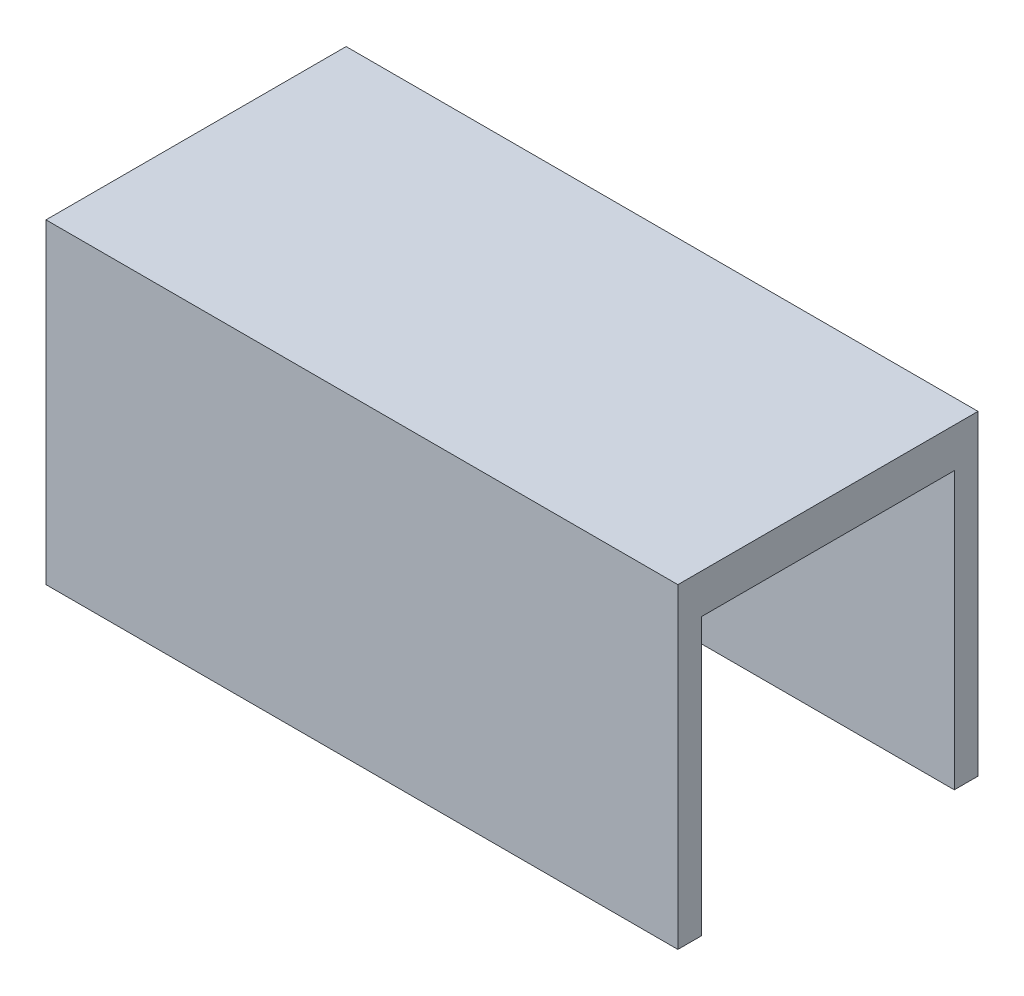
from build123d import *

# Parameters (mm, degrees)
BOSS_EXTRUDE1_DEPTH = 20
BOSS_EXTRUDE2_REACH = 35.26


with BuildPart() as part:
    # Sketch1 → Boss-Extrude1 (new, symmetric)
    with BuildSketch(Plane(origin=(0, 0, 0), x_dir=(0, 0, -1), z_dir=(1, 0, 0))):
        Polygon((-8, 0), (-8, 17.5), (8, 17.5), (8, 0), (9.5, 0), (9.5, 20), (-9.5, 20), (-9.5, 0), align=None)
    extrude(amount=BOSS_EXTRUDE1_DEPTH, both=True)

    # Sketch2 → Boss-Extrude2 (add, up to next)
    with BuildSketch(Plane(origin=(0, 0, 8), x_dir=(-1, 0, 0), z_dir=(0, 0, -1)), mode=Mode.PRIVATE) as boss_extrude2_sk1:
        with BuildLine():
            Line((20, 17.5), (20, 20))
            Line((20, 20), (-20, 20))
            Line((-20, 20), (-20, 17.5))
            ThreePointArc((-20, 17.5), (0, 9.985297678), (20, 17.5))
        make_face()
    boss_extrude2_tool1 = extrude(boss_extrude2_sk1.sketch, amount=BOSS_EXTRUDE2_REACH, mode=Mode.PRIVATE) - part.part
    add(boss_extrude2_tool1.solids().sort_by_distance((0, 15.86208, 8))[0])


solid = part.part
